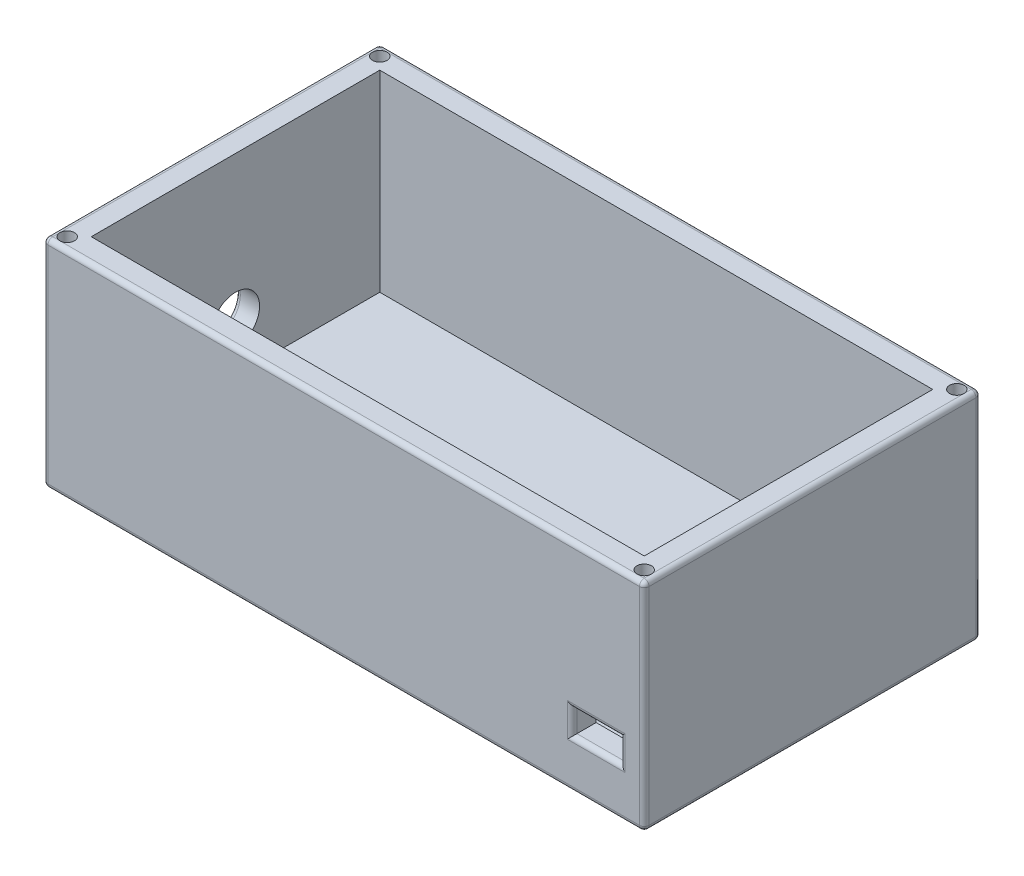
from build123d import *

# Parameters (mm, degrees)
SKETCH1_W               = 125
SKETCH1_H               = 70
BOSS_EXTRUDE1_DEPTH     = 5
CUT_EXTRUDE1_REACH      = 145.353
SKETCH2_R               = 2.5
SKETCH3_W               = 125
SKETCH3_H               = 70
SKETCH3_W_2             = 115
SKETCH3_H_2             = 60
BOSS_EXTRUDE2_DEPTH     = 40
CUT_EXTRUDE2_REACH      = 152.167
SKETCH4_R               = 5
CUT_EXTRUDE3_DEPTH      = 151.166574177
CUT_EXTRUDE3_DEPTH_BACK = 151.166574177
SKETCH6_W               = 10
SKETCH6_H               = 5
SKETCH7_R               = 1.5
CUT_EXTRUDE4_DEPTH      = 20
FILLET2_R               = 1


with BuildPart() as part:
    # Sketch1 → Boss-Extrude1 (new body)
    with BuildSketch(Plane(origin=(0, 0, 0), x_dir=(1, 0, 0), z_dir=(0, 1, 0))):
        with Locations((62.5, 35)):
            Rectangle(SKETCH1_W, SKETCH1_H)
    extrude(amount=BOSS_EXTRUDE1_DEPTH)

    # Sketch2 → Cut-Extrude1 (cut, up to next)
    with BuildSketch(Plane.XZ, mode=Mode.PRIVATE) as cut_extrude1_sk1:
        with Locations(Location((112.7, -14.6, 0), (0, 0, 270))):
            Circle(SKETCH2_R)
    cut_extrude1_tool1 = extrude(cut_extrude1_sk1.sketch, amount=-CUT_EXTRUDE1_REACH, mode=Mode.PRIVATE) & part.part
    # Sketch2 → Cut-Extrude1 (cut, up to next)
    with BuildSketch(Plane.XZ, mode=Mode.PRIVATE) as cut_extrude1_sk2:
        with Locations(Location((112.7, -55.4, 0), (0, 0, 270))):
            Circle(SKETCH2_R)
    cut_extrude1_tool2 = extrude(cut_extrude1_sk2.sketch, amount=-CUT_EXTRUDE1_REACH, mode=Mode.PRIVATE) & part.part
    # Sketch2 → Cut-Extrude1 (cut, up to next)
    with BuildSketch(Plane.XZ, mode=Mode.PRIVATE) as cut_extrude1_sk3:
        with Locations(Location((12.3, -14.6, 0), (0, 0, 270))):
            Circle(SKETCH2_R)
    cut_extrude1_tool3 = extrude(cut_extrude1_sk3.sketch, amount=-CUT_EXTRUDE1_REACH, mode=Mode.PRIVATE) & part.part
    add(cut_extrude1_tool1.solids().sort_by_distance((112.7, 0, -14.6))[0], mode=Mode.SUBTRACT)
    add(cut_extrude1_tool2.solids().sort_by_distance((112.7, 0, -55.4))[0], mode=Mode.SUBTRACT)
    add(cut_extrude1_tool3.solids().sort_by_distance((12.3, 0, -14.6))[0], mode=Mode.SUBTRACT)

    # Sketch3 → Boss-Extrude2 (add)
    with BuildSketch(Plane(origin=(0, 5, 0), x_dir=(1, 0, 0), z_dir=(0, 1, 0))):
        with Locations((62.5, 35)):
            Rectangle(SKETCH3_W, SKETCH3_H)
        with Locations((62.5, 35)):
            Rectangle(SKETCH3_W_2, SKETCH3_H_2, mode=Mode.SUBTRACT)
    extrude(amount=BOSS_EXTRUDE2_DEPTH)

    # Sketch4 → Cut-Extrude2 (cut, up to next)
    with BuildSketch(Plane.ZY, mode=Mode.PRIVATE) as cut_extrude2_sk1:
        with Locations((-35, 15)):
            Circle(SKETCH4_R)
    cut_extrude2_tool1 = extrude(cut_extrude2_sk1.sketch, amount=-CUT_EXTRUDE2_REACH, mode=Mode.PRIVATE) & part.part
    add(cut_extrude2_tool1.solids().sort_by_distance((0, 15, -35))[0], mode=Mode.SUBTRACT)

    # Sketch6 → Cut-Extrude3 (cut, two sides: drawn at the far end of the back side and taken through both)
    with BuildSketch(Plane(origin=(0, 0, -70), x_dir=(-1, 0, 0), z_dir=(0, 0, -1)).offset(-CUT_EXTRUDE3_DEPTH_BACK)):
        with Locations((-115, 12.5)):
            Rectangle(SKETCH6_W, SKETCH6_H)
    extrude(amount=CUT_EXTRUDE3_DEPTH + CUT_EXTRUDE3_DEPTH_BACK, mode=Mode.SUBTRACT)

    # Sketch7 → Cut-Extrude4 (cut)
    with BuildSketch(Plane(origin=(0, 45, 0), x_dir=(1, 0, 0), z_dir=(0, 1, 0))):
        with Locations(Location((2.5, 2.5, 0), (0, 0, 270))):
            Circle(SKETCH7_R)
        with Locations(Location((2.5, 67.5, 0), (0, 0, 90))):
            Circle(SKETCH7_R)
        with Locations(Location((122.5, 67.5, 0), (0, 0, 270))):
            Circle(SKETCH7_R)
        with Locations(Location((122.5, 2.5, 0), (0, 0, 90))):
            Circle(SKETCH7_R)
    extrude(amount=-CUT_EXTRUDE4_DEPTH, mode=Mode.SUBTRACT)

    # Fillet2
    fillet2_edges = [part.edges().sort_by_distance(p)[0] for p in [
        (12.3, 0, -12.1),
        (112.7, 0, -52.9),
        (112.7, 0, -12.1),
        (0, 45, -35),
        (62.5, 45, 0),
        (125, 45, -35),
        (62.5, 45, -70),
        (62.5, 0, -70),
        (125, 0, -35),
        (0, 15, -40),
        (62.5, 0, 0),
        (0, 0, -35),
        (110, 12.5, -70),
        (115, 10, -70),
        (120, 12.5, -70),
        (115, 15, -70),
        (110, 12.5, 0),
        (115, 10, 0),
        (120, 12.5, 0),
        (115, 15, 0),
        (0, 22.5, -70),
        (125, 22.5, -70),
        (125, 22.5, 0),
        (0, 22.5, 0),
    ]]
    fillet(fillet2_edges, radius=FILLET2_R - 0.0001)  # a hair under: the kernel refuses the full size


solid = part.part
